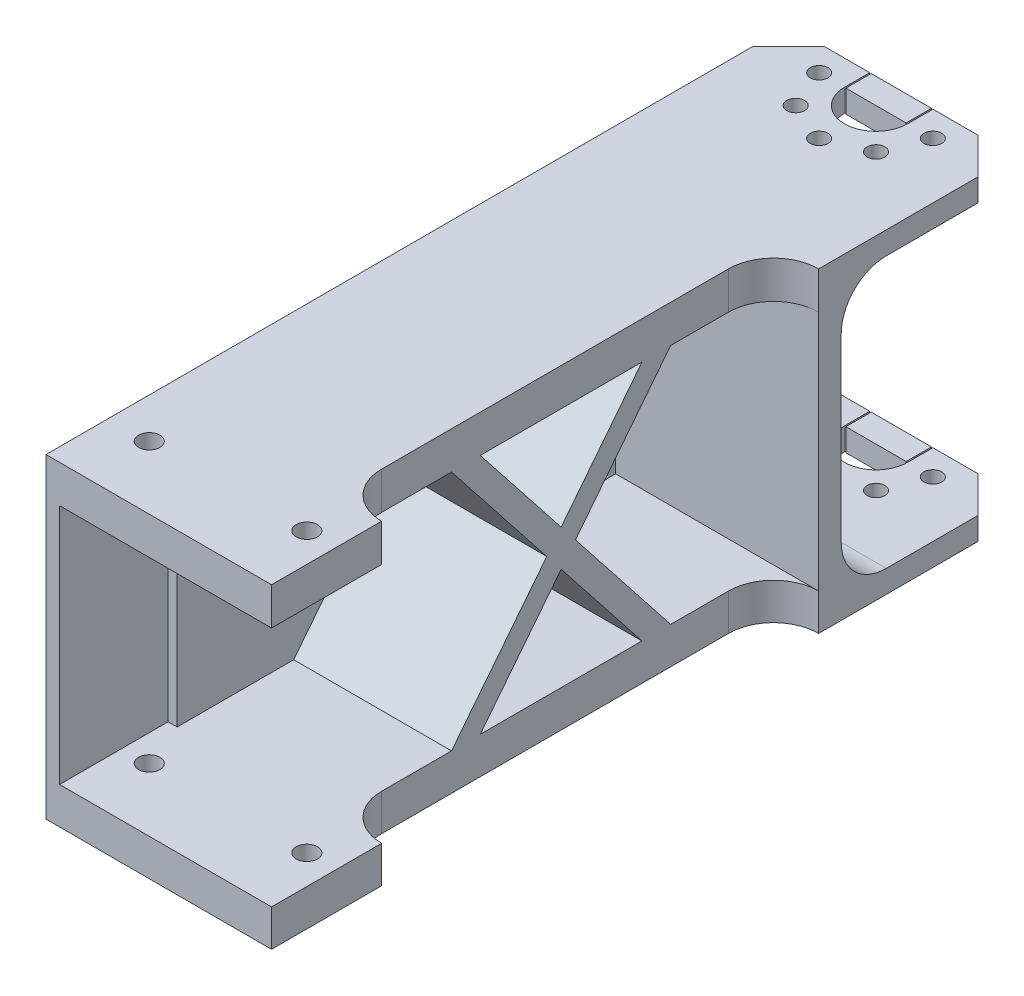
from build123d import *
from OCP.BRepAlgoAPI import BRepAlgoAPI_Cut
from OCP.TopTools import TopTools_ListOfShape

# Parameters (mm, degrees)
BOSS_EXTRUDE1_DEPTH     = 15.875
CUT_EXTRUDE1_DEPTH      = 122.108680794
CUT_EXTRUDE1_DEPTH_BACK = 122.108680794
SKETCH2_R               = 1.25
SKETCH2_R_2             = 1.239025097
CUT_EXTRUDE2_DEPTH      = 122.108680794
CUT_EXTRUDE2_DEPTH_BACK = 122.108680794
SKETCH4_R               = 4.445
SKETCH5_W               = 121.475
SKETCH5_H               = 44.451600063
BOSS_EXTRUDE2_DEPTH     = 3.175
SKETCH6_W               = 22.225
SKETCH6_H               = 5.276596581
SKETCH6_H_2             = 5.175003482
BOSS_EXTRUDE3_DEPTH     = 121.475
SKETCH7_R               = 1.375
CUT_EXTRUDE3_DEPTH      = 236.128722189
SKETCH8_W               = 9.525
SKETCH8_H               = 31.75
CUT_EXTRUDE4_DEPTH      = 236.128721531
FILLET3_R               = 3.81
BOSS_EXTRUDE4_DEPTH     = 22.225
LPATTERN1_COUNT         = 2
LPATTERN1_PITCH         = 38.1
FILLET5_R               = 6.35
SKETCH11_W              = 44.45
SKETCH11_H              = 44.451599086
CUT_EXTRUDE6_DEPTH      = 232.201459511
SKETCH12_W              = 29.976225149
SKETCH12_H              = 34
CUT_EXTRUDE7_DEPTH      = 22.225
SKETCH13_W              = 15.506537971
SKETCH13_H              = 5.175002505
SKETCH13_H_2            = 5.276596581
BOSS_EXTRUDE5_DEPTH     = 6.35
CUT_EXTRUDE8_REACH      = 123.775
SKETCH14_W              = 1.27
SKETCH14_H              = 34
SKETCH15_R              = 1.5
CUT_EXTRUDE9_DEPTH      = 193.350684139
FILLET6_R               = 6.35
CUT_EXTRUDE13_DEPTH     = 193.350684943
CHAMFER1_SIZE           = 5.08
SKETCH17_W              = 8.49
SKETCH17_H              = 3.56452339
BOSS_EXTRUDE6_DEPTH     = 3.175
SKETCH18_W              = 8.49
SKETCH18_H              = 3.56452339
BOSS_EXTRUDE7_DEPTH     = 3.175
BOSS_EXTRUDE8_DEPTH     = 63.5
BOSS_EXTRUDE9_DEPTH     = 63.5


with BuildPart() as part:
    # Sketch1 → Boss-Extrude1 (new, symmetric)
    with BuildSketch(Plane.ZY.offset(21)):
        Polygon((69.575, 19.101596581), (103.275, 19.101596581), (103.275, -19), (69.575, -19), (69.575, -22.175), (106.45, -22.175), (106.45, 22.276596581), (69.575, 22.276596581), align=None)
    extrude(amount=BOSS_EXTRUDE1_DEPTH, both=True)

    # Sketch2 → Cut-Extrude1 (cut, two sides: drawn at the far end of the back side and taken through both)
    with BuildSketch(Plane(origin=(0, 22.276596581, 0), x_dir=(1, 0, 0), z_dir=(0, 1, 0)).offset(-CUT_EXTRUDE1_DEPTH_BACK)):
        with Locations(Location((-15.343145751, -88.156854249, 0), (0, 0, 270))):
            Circle(SKETCH2_R)
        with Locations(Location((-21, -90.5, 0), (0, 0, 270))):
            Circle(SKETCH2_R)
        with Locations(Location((-26.656854249, -88.156854249, 0), (0, 0, 270))):
            Circle(SKETCH2_R)
        with Locations(Location((-29, -82.5, 0), (0, 0, 270))):
            Circle(SKETCH2_R)
        with Locations(Location((-26.656854249, -76.843145751, 0), (0, 0, 270))):
            Circle(SKETCH2_R)
        with Locations(Location((-21, -74.5, 0), (0, 0, 270))):
            Circle(SKETCH2_R_2)
        with Locations(Location((-15.343145751, -76.843145751, 0), (0, 0, 270))):
            Circle(SKETCH2_R)
        with Locations(Location((-13, -82.5, 0), (0, 0, 270))):
            Circle(SKETCH2_R)
    extrude(amount=CUT_EXTRUDE1_DEPTH + CUT_EXTRUDE1_DEPTH_BACK, mode=Mode.SUBTRACT)

    # Sketch4 → Cut-Extrude2 (cut, two sides: drawn at the far end of the back side and taken through both)
    with BuildSketch(Plane(origin=(0, 22.276596581, 0), x_dir=(1, 0, 0), z_dir=(0, 1, 0)).offset(-CUT_EXTRUDE2_DEPTH_BACK)):
        with Locations(Location((-21, -82.5, 0), (0, 0, 270))):
            Circle(SKETCH4_R)
    extrude(amount=CUT_EXTRUDE2_DEPTH + CUT_EXTRUDE2_DEPTH_BACK, mode=Mode.SUBTRACT)

    # Sketch5 → Boss-Extrude2 (add)
    with BuildSketch(Plane.ZY.offset(36.875)):
        with Locations((167.1875, 0.050796549)):
            Rectangle(SKETCH5_W, SKETCH5_H)
    extrude(amount=-BOSS_EXTRUDE2_DEPTH)

    # Sketch6 → Boss-Extrude3 (add)
    with BuildSketch(Plane.XY.offset(227.925)):
        with Locations((-22.5875, 19.63829829)):
            Rectangle(SKETCH6_W, SKETCH6_H)
        with Locations((-22.5875, -19.587501741)):
            Rectangle(SKETCH6_W, SKETCH6_H_2)
    extrude(amount=-BOSS_EXTRUDE3_DEPTH)

    # Sketch7 → Cut-Extrude3 (cut, through all)
    with BuildSketch(Plane(origin=(0, 22.276596581, 0), x_dir=(1, 0, 0), z_dir=(0, 1, 0))):
        with Locations(Location((-29, -221.5, 0), (0, 0, 270))):
            Circle(SKETCH7_R)
        with Locations(Location((-29, -199.5, 0), (0, 0, 270))):
            Circle(SKETCH7_R)
    extrude(amount=-CUT_EXTRUDE3_DEPTH, mode=Mode.SUBTRACT)


with BuildPart() as cut_extrude4_tool:
    # Sketch8 → Cut-Extrude4 (new, through all)
    with BuildSketch(Plane.XZ.offset(22.175)):
        with Locations((-16.2375, 212.05)):
            Rectangle(SKETCH8_W, SKETCH8_H)
    extrude(amount=-CUT_EXTRUDE4_DEPTH)


with BuildPart() as part_1:
    add(part.part)

    # Cut-Extrude4: cut by cut_extrude4_tool, with a tolerance
    cut_extrude4_stock = TopTools_ListOfShape()
    cut_extrude4_stock.Append(part_1.part.wrapped)
    cut_extrude4_tools = TopTools_ListOfShape()
    cut_extrude4_tools.Append(cut_extrude4_tool.part.wrapped)
    cut_extrude4_cut = BRepAlgoAPI_Cut()
    cut_extrude4_cut.SetArguments(cut_extrude4_stock)
    cut_extrude4_cut.SetTools(cut_extrude4_tools)
    cut_extrude4_cut.SetFuzzyValue(0.00001)
    cut_extrude4_cut.Build()
    add(Compound.cast(cut_extrude4_cut.Shape()).solids(), mode=Mode.REPLACE)

    # Fillet3
    fillet3_edges = [part_1.edges().sort_by_distance(p)[0] for p in [
        (-21, 19.63829829, 196.175),
        (-21, 19.63829829, 227.925),
        (-11.475, 19.63829829, 196.175),
        (-21, -19.5875, 196.175),
        (-21, -19.5875, 227.925),
        (-11.475, -19.5875, 196.175),
    ]]
    fillet(fillet3_edges, radius=FILLET3_R)

    # Sketch9 → Boss-Extrude4 (add)
    with BuildSketch(Plane(origin=(-11.475, 0, 0), x_dir=(0, 0, -1), z_dir=(1, 0, 0))):
        Polygon((-151.779979837, -17), (-138.378078062, 0), (-151.779979837, 17), (-147.737005037, 17), (-136.356590662, 2.564209645), (-124.976176286, 17), (-120.933201487, 17), (-134.335103262, 0), (-120.933201487, -17), (-124.976176286, -17), (-136.356590662, -2.564209645), (-147.737005037, -17), align=None)
    boss_extrude4 = extrude(amount=-BOSS_EXTRUDE4_DEPTH)

    # LPattern1: Boss-Extrude4 ×2
    with Locations(*[(0, 0, i * LPATTERN1_PITCH) for i in range(1, LPATTERN1_COUNT)]):
        add(boss_extrude4)

    # Fillet5
    fillet5_edges = [part_1.edges().sort_by_distance(p)[0] for p in [
        (-21, -19, 103.275),
        (-21, 19.101596581, 103.275),
    ]]
    fillet(fillet5_edges, radius=FILLET5_R)


with BuildPart() as cut_extrude6_tool:
    # Sketch11 → Cut-Extrude6 (new, through all)
    with BuildSketch(Plane.ZY.offset(36.875)):
        with Locations((205.7, 0.050797038)):
            Rectangle(SKETCH11_W, SKETCH11_H)
    extrude(amount=-CUT_EXTRUDE6_DEPTH)


with BuildPart() as part_2:
    add(part_1.part)

    # Cut-Extrude6: cut by cut_extrude6_tool, with a tolerance
    cut_extrude6_stock = TopTools_ListOfShape()
    cut_extrude6_stock.Append(part_2.part.wrapped)
    cut_extrude6_tools = TopTools_ListOfShape()
    cut_extrude6_tools.Append(cut_extrude6_tool.part.wrapped)
    cut_extrude6_cut = BRepAlgoAPI_Cut()
    cut_extrude6_cut.SetArguments(cut_extrude6_stock)
    cut_extrude6_cut.SetTools(cut_extrude6_tools)
    cut_extrude6_cut.SetFuzzyValue(0.00001)
    cut_extrude6_cut.Build()
    add(Compound.cast(cut_extrude6_cut.Shape()).solids(), mode=Mode.REPLACE)

    # Sketch12 → Cut-Extrude7 (cut)
    with BuildSketch(Plane(origin=(-11.475, 0, 0), x_dir=(0, 0, -1), z_dir=(1, 0, 0))):
        with Locations((-168.486887426, 0)):
            Rectangle(SKETCH12_W, SKETCH12_H)
    extrude(amount=-CUT_EXTRUDE7_DEPTH, mode=Mode.SUBTRACT)

    # Sketch13 → Boss-Extrude5 (add)
    with BuildSketch(Plane(origin=(-11.475, 0, 0), x_dir=(0, 0, -1), z_dir=(1, 0, 0))):
        with Locations((-175.721731015, -19.587501253)):
            Rectangle(SKETCH13_W, SKETCH13_H)
        with Locations((-175.721731015, 19.63829829)):
            Rectangle(SKETCH13_W, SKETCH13_H_2)
    extrude(amount=BOSS_EXTRUDE5_DEPTH)

    # Cut-Extrude8: up to this plane
    cut_extrude8_end = Plane(origin=(-6.028340513, -17, 167.9516971), z_dir=(-0.008438994035017815, 0, -0.99996439105584))
    # Sketch14 → Cut-Extrude8 (cut, up to the surface)
    with BuildSketch(Plane.XY.offset(183.475), mode=Mode.PRIVATE) as cut_extrude8_sk1:
        with Locations((-34.335, 0)):
            Rectangle(SKETCH14_W, SKETCH14_H)
    cut_extrude8_tool1 = split(extrude(cut_extrude8_sk1.sketch, amount=-CUT_EXTRUDE8_REACH, mode=Mode.PRIVATE), bisect_by=cut_extrude8_end, keep=Keep.BOTH, mode=Mode.PRIVATE)
    add(cut_extrude8_tool1.solids().sort_by_distance((-34.335, 0, 183.475))[0], mode=Mode.SUBTRACT)


with BuildPart() as cut_extrude9_tool:
    # Sketch15 → Cut-Extrude9 (new, through all)
    with BuildSketch(Plane.XZ.offset(22.175)):
        with Locations(Location((-9.224004247, 174.403895043, 0), (0, 0, 270))):
            Circle(SKETCH15_R)
        with Locations(Location((-31.22322085, 174.589552912, 0), (0, 0, 270))):
            Circle(SKETCH15_R)
    extrude(amount=-CUT_EXTRUDE9_DEPTH)


with BuildPart() as part_3:
    add(part_2.part)

    # Cut-Extrude9: cut by cut_extrude9_tool, with a tolerance
    cut_extrude9_stock = TopTools_ListOfShape()
    cut_extrude9_stock.Append(part_3.part.wrapped)
    cut_extrude9_tools = TopTools_ListOfShape()
    cut_extrude9_tools.Append(cut_extrude9_tool.part.wrapped)
    cut_extrude9_cut = BRepAlgoAPI_Cut()
    cut_extrude9_cut.SetArguments(cut_extrude9_stock)
    cut_extrude9_cut.SetTools(cut_extrude9_tools)
    cut_extrude9_cut.SetFuzzyValue(0.00001)
    cut_extrude9_cut.Build()
    add(Compound.cast(cut_extrude9_cut.Shape()).solids(), mode=Mode.REPLACE)

    # Fillet6
    fillet6_edges = [part_3.edges().sort_by_distance(p)[0] for p in [
        (-11.475, 19.63829829, 167.968462029),
        (-11.475, 19.63829829, 106.45),
        (-11.475, -19.5875, 106.45),
        (-11.475, -19.587501252, 167.968462029),
    ]]
    fillet(fillet6_edges, radius=FILLET6_R - 0.0001)  # a hair under: the kernel refuses the full size

    # Sketch16 → Cut-Extrude13 (cut, through all)
    with BuildSketch(Plane(origin=(0, 22.276596581, 0), x_dir=(1, 0, 0), z_dir=(0, 1, 0))):
        with BuildLine():
            Line((-36.875, -69.575), (-5.125, -69.575))
            Line((-5.125, -69.575), (-5.125, -78.93547661))
            Line((-5.125, -78.93547661), (-16.555, -78.93547661))
            Line((-16.555, -78.93547661), (-16.555, -82.5))
            ThreePointArc((-16.555, -82.5), (-21, -78.055), (-25.445, -82.5))
            Line((-25.445, -82.5), (-25.445, -78.93547661))
            Line((-25.445, -78.93547661), (-36.875, -78.93547661))
            Line((-36.875, -78.93547661), (-36.875, -69.575))
        make_face()
    extrude(amount=-CUT_EXTRUDE13_DEPTH, mode=Mode.SUBTRACT)

    # Chamfer1
    chamfer1_edges = [part_3.edges().sort_by_distance(p)[0] for p in [
        (-5.125, 20.689096581, 78.93547661),
        (-36.875, 20.689096581, 78.93547661),
        (-36.875, -20.5875, 78.93547661),
        (-5.125, -20.5875, 78.93547661),
    ]]
    chamfer(chamfer1_edges, length=CHAMFER1_SIZE)

    # Sketch19 → Boss-Extrude8 (add)
    with BuildSketch(Plane.XY.offset(164.425)):
        Polygon((-36.875, -22.175), (-34.335, -22.175), (-34.335, -27.1026), (-24.175, -27.1026), (-24.175, -29.6426), (-36.875, -29.6426), align=None)
    extrude(amount=-BOSS_EXTRUDE8_DEPTH)

    # Sketch20 → Boss-Extrude9 (add)
    with BuildSketch(Plane.XY.offset(164.425)):
        Polygon((-24.175, -27.1026), (-26.5626, -24.715), (-28.9502, -27.1026), align=None)
    extrude(amount=-BOSS_EXTRUDE9_DEPTH)


with BuildPart() as body_2:
    # Sketch17 → Boss-Extrude6 (new body)
    with BuildSketch(Plane(origin=(0, 22.276596581, 0), x_dir=(1, 0, 0), z_dir=(0, 1, 0))):
        with Locations((-21, -80.717738305)):
            Rectangle(SKETCH17_W, SKETCH17_H)
    extrude(amount=-BOSS_EXTRUDE6_DEPTH)


with BuildPart() as body_3:
    # Sketch18 → Boss-Extrude7 (new body)
    with BuildSketch(Plane.XZ.offset(22.175)):
        with Locations((-21, 80.717738305)):
            Rectangle(SKETCH18_W, SKETCH18_H)
    extrude(amount=-BOSS_EXTRUDE7_DEPTH)


solid = Compound([part_3.part, body_2.part, body_3.part])
